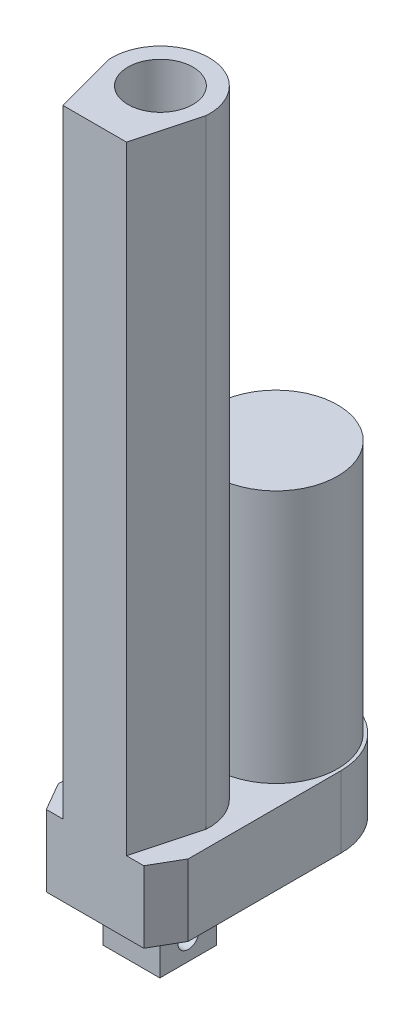
from build123d import *

# Parameters (mm, degrees)
SKETCH1_W             = 17.5
SKETCH1_H             = 17.5
BOSS_EXTRUDE1_DEPTH   = 16.5
SKETCH1_5_R           = 19
BOSS_EXTRUDE2_DEPTH   = 22
BOSS_EXTRUDE2_2_DEPTH = 22
SKETCH1_6_R           = 19
BOSS_EXTRUDE3_DEPTH   = 100
SKETCH1_9_R           = 10
BOSS_EXTRUDE5_DEPTH   = 212.2
SKETCH5_R             = 3.25
CUT_EXTRUDE2_DEPTH    = 19
SKETCH_4_W            = 30
SKETCH_4_H            = 22
EXTRUDE_1_DEPTH       = 53


with BuildPart() as part:
    # Sketch1 → Boss-Extrude1 (new body)
    with BuildSketch(Plane(origin=(0, 0, 0), x_dir=(1, 0, 0), z_dir=(0, 1, 0))):
        with Locations((1.649709476, -29.632563762)):
            Rectangle(SKETCH1_W, SKETCH1_H)
    extrude(amount=-BOSS_EXTRUDE1_DEPTH)



with BuildPart() as body_2:
    # Sketch1<5> → Boss-Extrude2 (new body)
    with BuildSketch(Plane(origin=(0, 0, 0), x_dir=(1, 0, 0), z_dir=(0, 1, 0))):
        with BuildLine():
            ThreePointArc((21.508100595, 6.229002252), (1.508100595, 26.229002252), (-18.491899405, 6.229002252))
            Line((-18.491899405, 6.229002252), (-18.491899405, -40.770997748))
            Line((-18.491899405, -40.770997748), (-13.491899405, -49.431251786))
            Line((-13.491899405, -49.431251786), (-8.393820498, -49.431251786))
            Line((-8.393820498, -49.431251786), (-13.577508022, -30.085466573))
            ThreePointArc((-13.577508022, -30.085466573), (1.396932955, -14.210185242), (16.371373933, -30.085466573))
            Line((16.371373933, -30.085466573), (11.187686408, -49.431251786))
            Line((11.187686408, -49.431251786), (16.508100595, -49.431251786))
            Line((16.508100595, -49.431251786), (21.508100595, -40.770997748))
            Line((21.508100595, -40.770997748), (21.508100595, 6.229002252))
        make_face()
        with Locations((1.508100595, 6.229002252)):
            Circle(SKETCH1_5_R, mode=Mode.SUBTRACT)
    extrude(amount=BOSS_EXTRUDE2_DEPTH)

    # Sketch1<6> → Boss-Extrude3 (add)
    with BuildSketch(Plane(origin=(0, 0, 0), x_dir=(1, 0, 0), z_dir=(0, 1, 0))):
        with Locations((1.508100595, 6.229002252)):
            Circle(SKETCH1_6_R)
    extrude(amount=BOSS_EXTRUDE3_DEPTH)


with BuildPart() as body_3:
    # Sketch1<5> → Boss-Extrude2 2 (new body)
    with BuildSketch(Plane(origin=(0, 0, 0), x_dir=(1, 0, 0), z_dir=(0, 1, 0))):
        with BuildLine():
            Line((-4.139376328, -20.882563762), (-7.100290524, -20.882563762))
            Line((-7.100290524, -20.882563762), (-7.100290524, -23.937880894))
            ThreePointArc((-7.100290524, -23.937880894), (-8.603067045, -29.210185242), (-7.100290524, -34.48248959))
            Line((-7.100290524, -34.48248959), (-7.100290524, -38.382563762))
            Line((-7.100290524, -38.382563762), (-2.586466634, -38.382563762))
            ThreePointArc((-2.586466634, -38.382563762), (1.396932955, -39.210185242), (5.380332545, -38.382563762))
            Line((5.380332545, -38.382563762), (10.399709476, -38.382563762))
            Line((10.399709476, -38.382563762), (10.399709476, -33.563346728))
            ThreePointArc((10.399709476, -33.563346728), (11.396932955, -29.210185242), (10.399709476, -24.857023756))
            Line((10.399709476, -24.857023756), (10.399709476, -20.882563762))
            Line((10.399709476, -20.882563762), (6.933242239, -20.882563762))
            ThreePointArc((6.933242239, -20.882563762), (1.396932955, -19.210185242), (-4.139376328, -20.882563762))
        make_face()
    extrude(amount=BOSS_EXTRUDE2_2_DEPTH)


with BuildPart() as part_1:
    add(part.part)

    add(body_2.part)  # Boss-Extrude5 merges body 2
    # Sketch1<9> → Boss-Extrude5 (add)
    with BuildSketch(Plane(origin=(0, 0, 0), x_dir=(1, 0, 0), z_dir=(0, 1, 0))):
        with BuildLine():
            Line((-13.577508022, -30.085466573), (-8.393820498, -49.431251786))
            Line((-8.393820498, -49.431251786), (11.187686408, -49.431251786))
            Line((11.187686408, -49.431251786), (16.371373933, -30.085466573))
            ThreePointArc((16.371373933, -30.085466573), (1.396932955, -14.210185242), (-13.577508022, -30.085466573))
        make_face()
        with Locations((1.396932955, -29.210185242)):
            Circle(SKETCH1_9_R, mode=Mode.SUBTRACT)
    extrude(amount=BOSS_EXTRUDE5_DEPTH)

    # Sketch5 → Cut-Extrude2 (cut)
    with BuildSketch(Plane(origin=(10.399709476, 0, 0), x_dir=(0, 0, -1), z_dir=(1, 0, 0))):
        with Locations((-29.632563762, -10)):
            Circle(SKETCH5_R)
    extrude(amount=-CUT_EXTRUDE2_DEPTH, mode=Mode.SUBTRACT)


    add(body_3.part)  # 凸台-拉伸1 merges body 3
    # 草图4 → 凸台-拉伸1 (add)
    with BuildSketch(Plane.XY.offset(49.431251786)):
        with Locations((1.508100595, 11)):
            Rectangle(SKETCH_4_W, SKETCH_4_H)
    extrude(amount=-EXTRUDE_1_DEPTH)


solid = part_1.part
